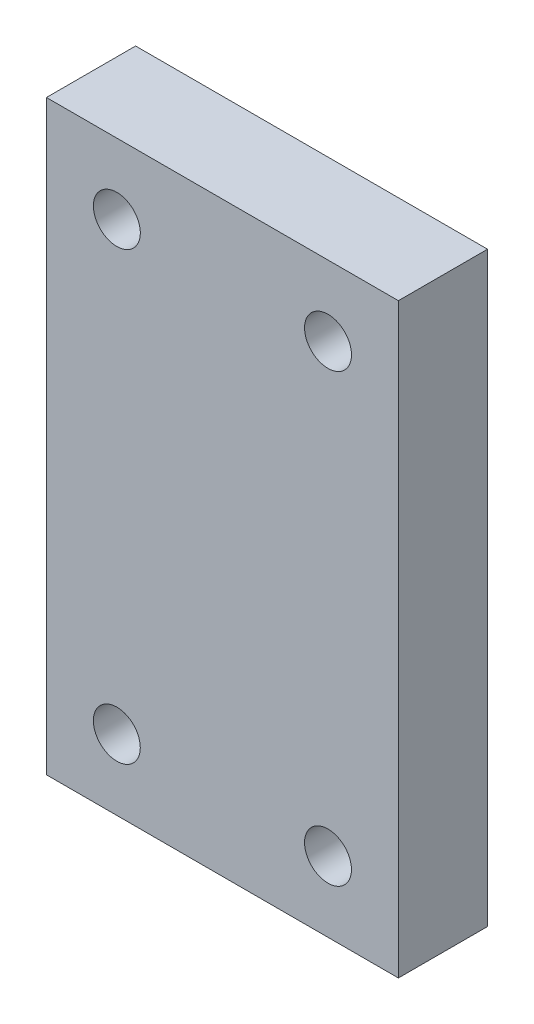
from build123d import *

# Parameters (mm, degrees)
SKETCH1_W           = 38.1
SKETCH1_H           = 63.5
SKETCH1_R           = 2.54
BOSS_EXTRUDE1_DEPTH = 9.652


with BuildPart() as part:
    # Sketch1 → Boss-Extrude1 (new body)
    with BuildSketch(Plane.XY):
        with Locations((-29.594105975, 62.392212855)):
            Rectangle(SKETCH1_W, SKETCH1_H)
        with Locations((-41.024105975, 38.262212855)):
            Circle(SKETCH1_R, mode=Mode.SUBTRACT)
        with Locations((-18.164105975, 38.262212855)):
            Circle(SKETCH1_R, mode=Mode.SUBTRACT)
        with Locations((-18.164105975, 86.522212855)):
            Circle(SKETCH1_R, mode=Mode.SUBTRACT)
        with Locations((-41.024105975, 86.522212855)):
            Circle(SKETCH1_R, mode=Mode.SUBTRACT)
    extrude(amount=BOSS_EXTRUDE1_DEPTH)


solid = part.part
